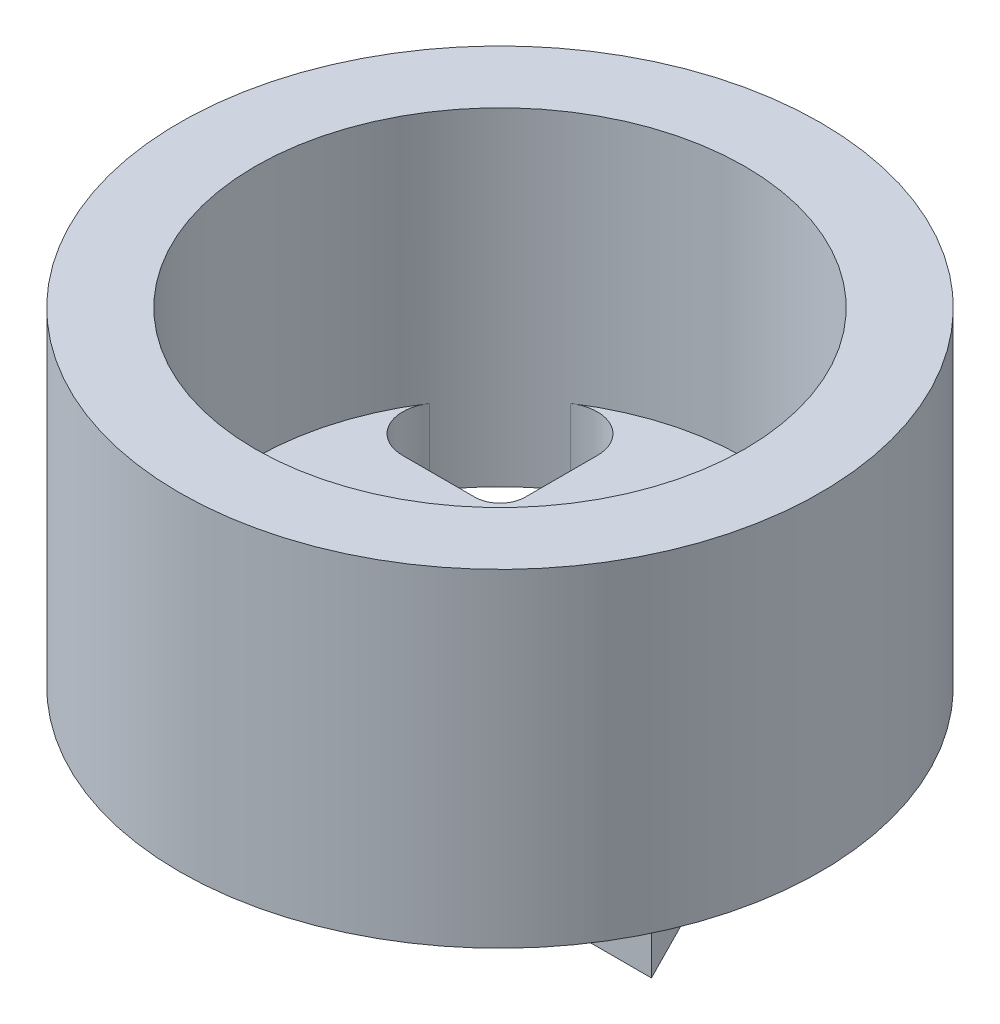
from build123d import *

# Parameters (mm, degrees)
ESBO_O1_R                     = 12.7
ESBO_O1_R_2                   = 9.7
RESSALTO_EXTRUS_O1_DEPTH      = 13
RESSALTO_EXTRUS_O7_DEPTH      = 3
FILETE1_R                     = 1.5
FILETE2_R                     = 1
RESSALTO_EXTRUS_O8_DEPTH      = 3
RESSALTO_EXTRUS_O8_DEPTH_BACK = 3


with BuildPart() as part:
    # Esboço1 → Ressalto-extrusão1 (new body)
    with BuildSketch(Plane(origin=(0, 0, 0), x_dir=(1, 0, 0), z_dir=(0, 1, 0))):
        with Locations(Location((0, 0, 0), (0, 0, 90))):
            Circle(ESBO_O1_R)
        with Locations(Location((0, 0, 0), (0, 0, 90))):
            Circle(ESBO_O1_R_2, mode=Mode.SUBTRACT)
    extrude(amount=RESSALTO_EXTRUS_O1_DEPTH)

    # Esboço5 → Ressalto-extrusão7 (add)
    with BuildSketch(Plane.XZ):
        with BuildLine():
            ThreePointArc((-10.270832488, -3), (-7.566042559, -7.566042559), (-3, -10.270832488))
            Line((-3, -10.270832488), (-3, -9.224424101))
            ThreePointArc((-3, -9.224424101), (-6.858935778, -6.858935778), (-9.224424101, -3))
            Line((-9.224424101, -3), (-10.270832488, -3))
        make_face()
        with BuildLine():
            ThreePointArc((-3, -10.270832488), (0, -10.7), (3, -10.270832488))
            Line((3, -10.270832488), (3, -9.224424101))
            ThreePointArc((3, -9.224424101), (0, -9.7), (-3, -9.224424101))
            Line((-3, -9.224424101), (-3, -10.270832488))
        make_face()
        with BuildLine():
            ThreePointArc((3, 10.270832488), (0, 10.7), (-3, 10.270832488))
            Line((-3, 10.270832488), (-3, 9.224424101))
            ThreePointArc((-3, 9.224424101), (0, 9.7), (3, 9.224424101))
            Line((3, 9.224424101), (3, 10.270832488))
        make_face()
        with BuildLine():
            Line((3, -9.224424101), (3, -10.270832488))
            ThreePointArc((3, -10.270832488), (7.566042559, -7.566042559), (10.270832488, -3))
            Line((10.270832488, -3), (9.224424101, -3))
            ThreePointArc((9.224424101, -3), (6.858935778, -6.858935778), (3, -9.224424101))
        make_face()
        with BuildLine():
            Line((9.224424101, -3), (10.270832488, -3))
            ThreePointArc((10.270832488, -3), (10.592164737, -1.515270995), (10.7, 0))
            ThreePointArc((10.7, 0), (10.592164737, 1.515270995), (10.270832488, 3))
            Line((10.270832488, 3), (9.224424101, 3))
            ThreePointArc((9.224424101, 3), (9.580368307, 1.518730756), (9.7, 0))
            ThreePointArc((9.7, 0), (9.580368307, -1.518730756), (9.224424101, -3))
        make_face()
        with BuildLine():
            ThreePointArc((-10.270832488, 3), (-10.7, 0), (-10.270832488, -3))
            Line((-10.270832488, -3), (-9.224424101, -3))
            ThreePointArc((-9.224424101, -3), (-9.7, 0), (-9.224424101, 3))
            Line((-9.224424101, 3), (-10.270832488, 3))
        make_face()
        with BuildLine():
            Line((9.224424101, 3), (10.270832488, 3))
            ThreePointArc((10.270832488, 3), (7.566042559, 7.566042559), (3, 10.270832488))
            Line((3, 10.270832488), (3, 9.224424101))
            ThreePointArc((3, 9.224424101), (6.858935778, 6.858935778), (9.224424101, 3))
        make_face()
        with BuildLine():
            ThreePointArc((-3, 10.270832488), (-7.566042559, 7.566042559), (-10.270832488, 3))
            Line((-10.270832488, 3), (-9.224424101, 3))
            ThreePointArc((-9.224424101, 3), (-6.858935778, 6.858935778), (-3, 9.224424101))
            Line((-3, 9.224424101), (-3, 10.270832488))
        make_face()
        with BuildLine():
            Line((-9.224424101, -3), (-3, -3))
            Line((-3, -3), (-3, 0))
            Line((-3, 0), (-3, 3))
            Line((-3, 3), (-9.224424101, 3))
            ThreePointArc((-9.224424101, 3), (-9.7, 0), (-9.224424101, -3))
        make_face()
        with BuildLine():
            ThreePointArc((-3, -9.224424101), (0, -9.7), (3, -9.224424101))
            Line((3, -9.224424101), (3, -3))
            Line((3, -3), (0, -3))
            Line((0, -3), (-3, -3))
            Line((-3, -3), (-3, -9.224424101))
        make_face()
        with BuildLine():
            Line((3, 0), (3, -3))
            Line((3, -3), (9.224424101, -3))
            ThreePointArc((9.224424101, -3), (9.580368307, -1.518730756), (9.7, 0))
            ThreePointArc((9.7, 0), (9.580368307, 1.518730756), (9.224424101, 3))
            Line((9.224424101, 3), (3, 3))
            Line((3, 3), (3, 0))
        make_face()
        with BuildLine():
            Line((0, -3), (3, -3))
            Line((3, -3), (3, 0))
            ThreePointArc((3, 0), (2.121320344, -2.121320344), (0, -3))
        make_face()
        with BuildLine():
            Line((-3, -3), (0, -3))
            ThreePointArc((0, -3), (-2.121320344, -2.121320344), (-3, 0))
            Line((-3, 0), (-3, -3))
        make_face()
        with BuildLine():
            ThreePointArc((-3, 0), (-2.121320344, 2.121320344), (0, 3))
            Line((0, 3), (-3, 3))
            Line((-3, 3), (-3, 0))
        make_face()
        with BuildLine():
            ThreePointArc((0, 3), (2.121320344, 2.121320344), (3, 0))
            Line((3, 0), (3, 3))
            Line((3, 3), (0, 3))
        make_face()
        with BuildLine():
            Line((0, 3), (3, 3))
            Line((3, 3), (3, 9.224424101))
            ThreePointArc((3, 9.224424101), (0, 9.7), (-3, 9.224424101))
            Line((-3, 9.224424101), (-3, 3))
            Line((-3, 3), (0, 3))
        make_face()
    extrude(amount=-RESSALTO_EXTRUS_O7_DEPTH)

    # Filete1
    # the kernel refuses this fillet: 1.5 mm, written as the material it adds along each edge
    with BuildSketch(Plane(origin=(-9.224424101, 0, -3), x_dir=(0.4328657802637883, 0, -0.9014583829975857), z_dir=(0, 1, 0)), Plane(origin=(-3, 0, 9.224424101), x_dir=(-0.9014583829975888, 0, -0.43286578026378153), z_dir=(0, 1, 0)), Plane(origin=(3, 0, -9.224424101), x_dir=(0.9014583829975941, 0, 0.4328657802637706), z_dir=(0, 1, 0)), Plane(origin=(9.224424101, 0, 3), x_dir=(-0.43286578026378625, 0, 0.9014583829975866), z_dir=(0, 1, 0))) as filete1_piece_1:
        with BuildLine():
            CenterArc((2.377862549, -1.486705945), FILETE1_R, 82.366178215, 123.283389503)
            Line((1.025674975, -2.136004615), (0, 0))
            ThreePointArc((0, 0), (1.288562387, 0.085968225), (2.577124774, 0))
        make_face()
    extrude(amount=3)
    with BuildSketch(Plane(origin=(-3, 0, -9.224424101), x_dir=(-0.9014583829975884, 0, 0.43286578026378264), z_dir=(0, 1, 0)), Plane(origin=(-9.224424101, 0, 3), x_dir=(0.4328657802637885, 0, 0.9014583829975855), z_dir=(0, 1, 0)), Plane(origin=(9.224424101, 0, -3), x_dir=(-0.43286578026378775, 0, -0.9014583829975858), z_dir=(0, 1, 0)), Plane(origin=(3, 0, 9.224424101), x_dir=(0.9014583829975935, 0, -0.43286578026377187), z_dir=(0, 1, 0))) as filete1_piece_2:
        with BuildLine():
            CenterArc((2.377862549, 1.486705945), FILETE1_R, 154.350432282, 123.283389503)
            Line((1.025674975, 2.136004615), (0, 0))
            ThreePointArc((0, 0), (1.288562387, -0.085968225), (2.577124774, 0))
        make_face()
    extrude(amount=3)

    # Filete2
    filete2_edges = [part.edges().sort_by_distance(p)[0] for p in [
        (3, 1.5, -3),
        (3, 1.5, 3),
        (-3, 1.5, 3),
        (-3, 1.5, -3),
    ]]
    fillet(filete2_edges, radius=FILETE2_R)


with BuildPart() as body_2:
    # Esboço6 → Ressalto-extrusão8 (new, two sides: drawn at the far end of the back side and taken through both)
    with BuildSketch(Plane(origin=(0, 0, 0), x_dir=(0, 0, -1), z_dir=(1, 0, 0)).offset(-RESSALTO_EXTRUS_O8_DEPTH_BACK)):
        Polygon((3, 0), (12.7, 0), (3, -10), align=None)
    extrude(amount=RESSALTO_EXTRUS_O8_DEPTH + RESSALTO_EXTRUS_O8_DEPTH_BACK)


solid = Compound([part.part, body_2.part])
